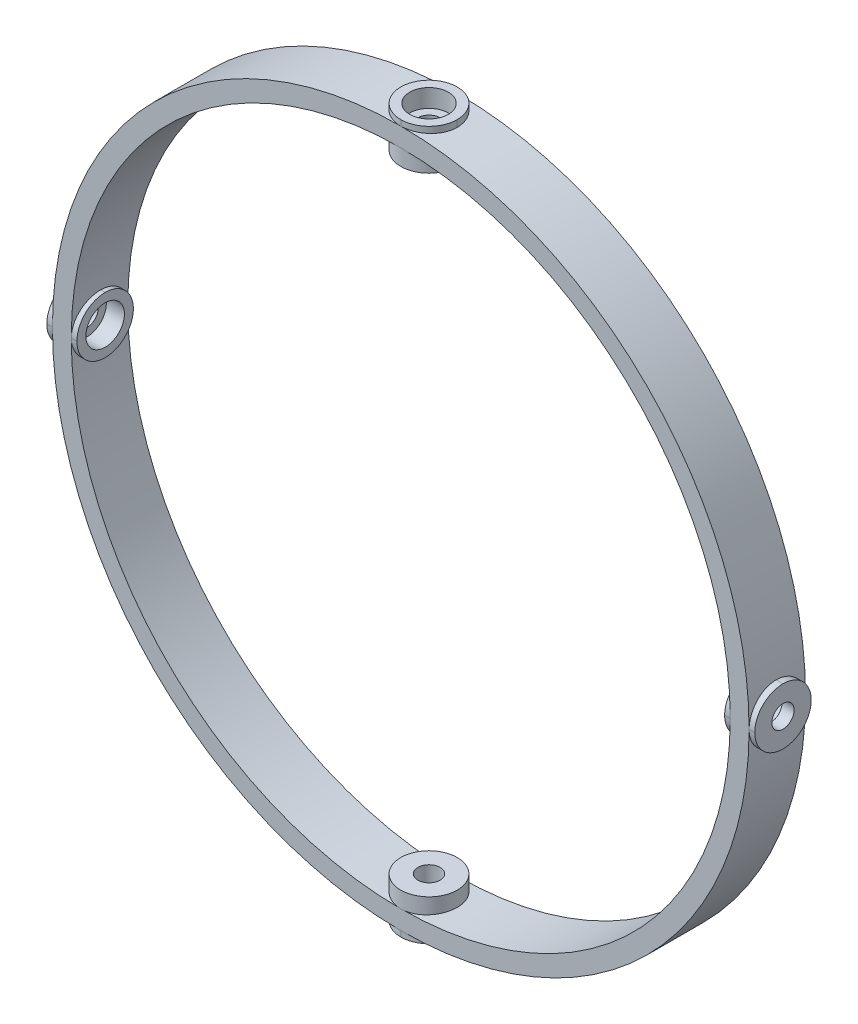
from build123d import *

# Parameters (mm, degrees)
SKETCH1_R           = 58.7375
SKETCH1_R_2         = 55.5625
BOSS_EXTRUDE1_DEPTH = 9.525
SKETCH2_W           = 9.525
SKETCH2_H           = 5.08
SKETCH2_W_2         = 5.08
SKETCH2_H_2         = 9.525
BOSS_EXTRUDE2_DEPTH = 9.525
SKETCH3_R           = 1.875
CUT_EXTRUDE1_DEPTH  = 134.810336391
SKETCH6_R           = 1.875
CUT_EXTRUDE4_DEPTH  = 134.810336391
SKETCH4_R           = 3.25
CUT_EXTRUDE2_DEPTH  = 3.048
CUT_EXTRUDE3_START  = -3.048
SKETCH5_R           = 3.25
CUT_EXTRUDE3_DEPTH  = 3.048
SKETCH10_R          = 3.25
CUT_EXTRUDE6_DEPTH  = 3.048
CUT_EXTRUDE7_START  = -3.048
SKETCH11_R          = 3.25
CUT_EXTRUDE7_DEPTH  = 3.048
FILLET1_R           = 4.7625
BOSS_EXTRUDE3_START = 1.778
SKETCH12_R          = 1.875
BOSS_EXTRUDE3_DEPTH = 1.778
SKETCH13_R          = 1.875
BOSS_EXTRUDE4_DEPTH = 1.778


with BuildPart() as part:
    # Sketch1 → Boss-Extrude1 (new body)
    with BuildSketch(Plane.XY):
        with Locations(Location((0, 0, 0), (0, 0, 180))):
            Circle(SKETCH1_R)
        with Locations(Location((0, 0, 0), (0, 0, 180))):
            Circle(SKETCH1_R_2, mode=Mode.SUBTRACT)
    extrude(amount=BOSS_EXTRUDE1_DEPTH)

    # Sketch2 → Boss-Extrude2 (add)
    with BuildSketch(Plane.XY.offset(9.525)):
        with Locations((0, -57.15)):
            Rectangle(SKETCH2_W, SKETCH2_H)
        with Locations((0, 57.15)):
            Rectangle(SKETCH2_W, SKETCH2_H)
        with Locations((57.15, 0)):
            Rectangle(SKETCH2_W_2, SKETCH2_H_2)
        with Locations((-57.15, 0)):
            Rectangle(SKETCH2_W_2, SKETCH2_H_2)
    extrude(amount=-BOSS_EXTRUDE2_DEPTH)

    # Sketch3 → Cut-Extrude1 (cut, through all)
    with BuildSketch(Plane.XZ.offset(59.69)):
        with Locations((0, 4.7625)):
            Circle(SKETCH3_R)
    extrude(amount=-CUT_EXTRUDE1_DEPTH, mode=Mode.SUBTRACT)

    # Sketch6 → Cut-Extrude4 (cut, through all)
    with BuildSketch(Plane.ZY.offset(59.69)):
        with Locations((4.7625, 0)):
            Circle(SKETCH6_R)
    extrude(amount=-CUT_EXTRUDE4_DEPTH, mode=Mode.SUBTRACT)

    # Sketch4 → Cut-Extrude2 (cut)
    with BuildSketch(Plane.XZ.offset(59.69)):
        with Locations((0, 4.7625)):
            Circle(SKETCH4_R)
    extrude(amount=-CUT_EXTRUDE2_DEPTH, mode=Mode.SUBTRACT)

    # Sketch5 → Cut-Extrude3 (cut)
    with BuildSketch(Plane(origin=(0, 59.69, 0), x_dir=(1, 0, 0), z_dir=(0, 1, 0)).offset(CUT_EXTRUDE3_START)):
        with Locations((0, -4.7625)):
            Circle(SKETCH5_R)
    extrude(amount=CUT_EXTRUDE3_DEPTH, mode=Mode.SUBTRACT)

    # Sketch10 → Cut-Extrude6 (cut)
    with BuildSketch(Plane.ZY.offset(-54.61)):
        with Locations((4.7625, 0)):
            Circle(SKETCH10_R)
    extrude(amount=-CUT_EXTRUDE6_DEPTH, mode=Mode.SUBTRACT)

    # Sketch11 → Cut-Extrude7 (cut)
    with BuildSketch(Plane(origin=(-54.61, 0, 0), x_dir=(0, 0, -1), z_dir=(1, 0, 0)).offset(CUT_EXTRUDE7_START)):
        with Locations(Location((-4.7625, 0, 0), (0, 0, 180))):
            Circle(SKETCH11_R)
    extrude(amount=CUT_EXTRUDE7_DEPTH, mode=Mode.SUBTRACT)

    # Fillet1
    fillet1_edges = [part.edges().sort_by_distance(p)[0] for p in [
        (4.7625, -59.117053652, 0),
        (4.7625, -59.117053652, 9.525),
        (-4.7625, -59.117053652, 0),
        (-4.7625, -59.117053652, 9.525),
        (4.7625, -54.984008291, 0),
        (4.7625, -54.984008291, 9.525),
        (-4.7625, -54.984008291, 0),
        (-4.7625, -54.984008291, 9.525),
        (-4.7625, 59.117053652, 0),
        (-4.7625, 59.117053652, 9.525),
        (4.7625, 59.117053652, 0),
        (4.7625, 59.117053652, 9.525),
        (4.7625, 54.984008291, 0),
        (4.7625, 54.984008291, 9.525),
        (-4.7625, 54.984008291, 0),
        (-4.7625, 54.984008291, 9.525),
        (-54.984008291, -4.7625, 0),
        (-54.984008291, -4.7625, 9.525),
        (-54.984008291, 4.7625, 0),
        (-54.984008291, 4.7625, 9.525),
        (-59.117053652, 4.7625, 0),
        (-59.117053652, 4.7625, 9.525),
        (-59.117053652, -4.7625, 0),
        (-59.117053652, -4.7625, 9.525),
        (54.984008291, 4.7625, 0),
        (54.984008291, 4.7625, 9.525),
        (54.984008291, -4.7625, 0),
        (54.984008291, -4.7625, 9.525),
        (59.117053652, 4.7625, 0),
        (59.117053652, 4.7625, 9.525),
        (59.117053652, -4.7625, 0),
        (59.117053652, -4.7625, 9.525),
    ]]
    fillet(fillet1_edges, radius=FILLET1_R - 0.0001)  # a hair under: the kernel refuses the full size

    # Sketch12 → Boss-Extrude3 (add)
    with BuildSketch(Plane.XZ.offset(-54.61).offset(BOSS_EXTRUDE3_START)):
        with BuildLine():
            ThreePointArc((-4.7625, 4.7625), (-3.367596045, 1.394903955), (0, 0))
            ThreePointArc((0, 0), (3.367596045, 1.394903955), (4.7625, 4.7625))
            ThreePointArc((4.7625, 4.7625), (3.367596045, 8.130096045), (0, 9.525))
            ThreePointArc((0, 9.525), (-3.367596045, 8.130096045), (-4.7625, 4.7625))
        make_face()
        with Locations(Location((0, 4.7625, 0), (0, 0, 270))):
            Circle(SKETCH12_R, mode=Mode.SUBTRACT)
    extrude(amount=-BOSS_EXTRUDE3_DEPTH)

    # Sketch13 → Boss-Extrude4 (add)
    with BuildSketch(Plane(origin=(0, -54.61, 0), x_dir=(1, 0, 0), z_dir=(0, 1, 0))):
        with BuildLine():
            ThreePointArc((-4.7625, -4.7625), (-3.367596045, -8.130096045), (0, -9.525))
            ThreePointArc((0, -9.525), (3.367596045, -8.130096045), (4.7625, -4.7625))
            ThreePointArc((4.7625, -4.7625), (3.367596045, -1.394903955), (0, 0))
            ThreePointArc((0, 0), (-3.367596045, -1.394903955), (-4.7625, -4.7625))
        make_face()
        with Locations(Location((0, -4.7625, 0), (0, 0, 90))):
            Circle(SKETCH13_R, mode=Mode.SUBTRACT)
    extrude(amount=BOSS_EXTRUDE4_DEPTH)


solid = part.part
